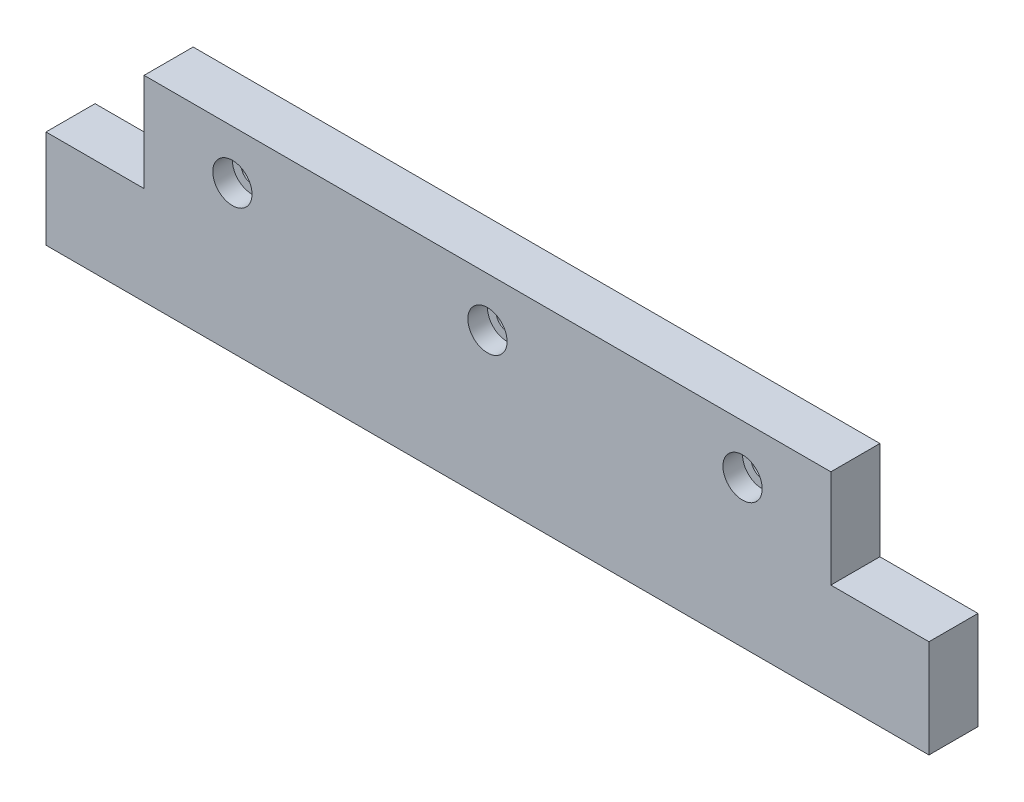
from build123d import *

# Parameters (mm, degrees)
DODANIE_WYCI_GNI_CIE1_DEPTH = 10
SZKIC2_R                    = 2.2
WYTNIJ_WYCI_GNI_CIE1_DEPTH  = 10
SZKIC3_R                    = 4
SZKIC3_R_2                  = 2.2
WYTNIJ_WYCI_GNI_CIE2_DEPTH  = 4


with BuildPart() as part:
    # Szkic1 → Dodanie-wyciągnięcie1 (new body)
    with BuildSketch(Plane.XY):
        Polygon((0, -20), (-20, -20), (-20, -40), (160, -40), (160, -20), (140, -20), (140, 0), (0, 0), align=None)
    extrude(amount=DODANIE_WYCI_GNI_CIE1_DEPTH)

    # Szkic2 → Wytnij-wyciągnięcie1 (cut)
    with BuildSketch(Plane.XY.offset(10)):
        with Locations((18, -10)):
            Circle(SZKIC2_R)
        with Locations((70, -10)):
            Circle(SZKIC2_R)
        with Locations((122, -10)):
            Circle(SZKIC2_R)
    extrude(amount=-WYTNIJ_WYCI_GNI_CIE1_DEPTH, mode=Mode.SUBTRACT)

    # Szkic3 → Wytnij-wyciągnięcie2 (cut)
    # profile 1 of 3: a face of its own
    with BuildSketch(Plane.XY.offset(10)):
        with Locations((18, -10)):
            Circle(SZKIC3_R)
        with Locations((18, -10)):
            Circle(SZKIC3_R_2, mode=Mode.SUBTRACT)
    # profile 2 of 3: a face of its own
    with BuildSketch(Plane.XY.offset(10)):
        with Locations((70, -10)):
            Circle(SZKIC3_R)
        with Locations((70, -10)):
            Circle(SZKIC3_R_2, mode=Mode.SUBTRACT)
    # profile 3 of 3: a face of its own
    with BuildSketch(Plane.XY.offset(10)):
        with Locations((122, -10)):
            Circle(SZKIC3_R)
        with Locations((122, -10)):
            Circle(SZKIC3_R_2, mode=Mode.SUBTRACT)
    extrude(amount=-WYTNIJ_WYCI_GNI_CIE2_DEPTH, mode=Mode.SUBTRACT)


solid = part.part
